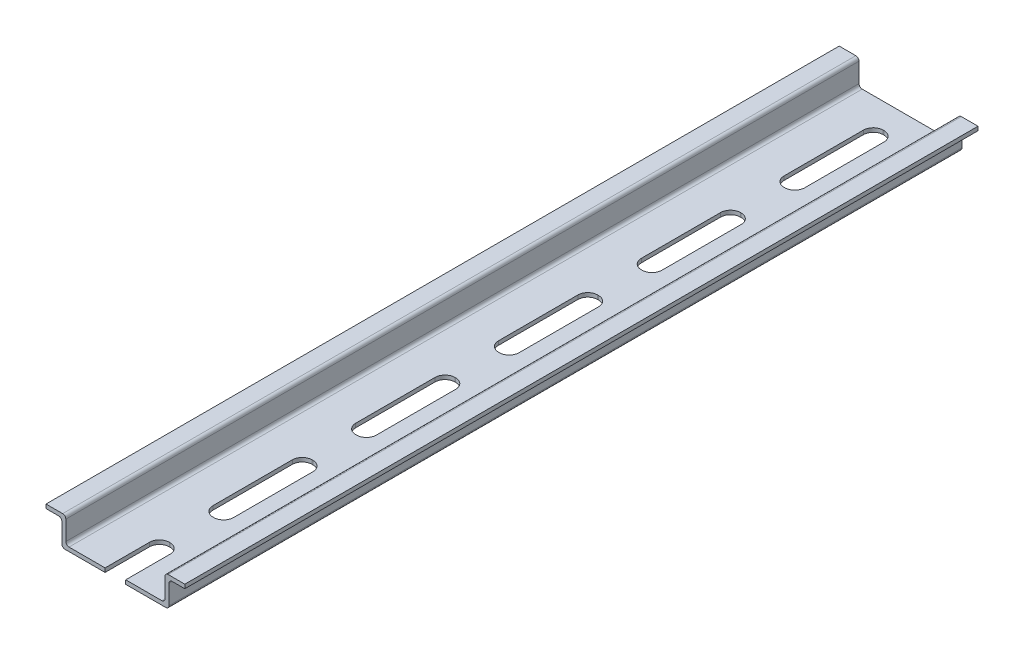
from build123d import *

# Parameters (mm, degrees)
BOSS_EXTRUDE1_DEPTH = 200
CUT_EXTRUDE1_DEPTH  = 204.143422242


with BuildPart() as part:
    # Sketch1 → Boss-Extrude1 (new body)
    with BuildSketch(Plane.XY):
        with BuildLine():
            Line((0, 0), (0, 1))
            Line((0, 1), (4.2, 1))
            ThreePointArc((4.2, 1), (4.765685425, 0.765685425), (5, 0.2))
            Line((5, 0.2), (5, -4.7))
            ThreePointArc((5, -4.7), (5.234314575, -5.265685425), (5.8, -5.5))
            Line((5.8, -5.5), (29.2, -5.5))
            ThreePointArc((29.2, -5.5), (29.765685425, -5.265685425), (30, -4.7))
            Line((30, -4.7), (30, 0.2))
            ThreePointArc((30, 0.2), (30.234314575, 0.765685425), (30.8, 1))
            Line((30.8, 1), (35, 1))
            Line((35, 1), (35, 0))
            Line((35, 0), (31.8, 0))
            ThreePointArc((31.8, 0), (31.234314575, -0.234314575), (31, -0.8))
            Line((31, -0.8), (31, -5.7))
            ThreePointArc((31, -5.7), (30.765685425, -6.265685425), (30.2, -6.5))
            Line((30.2, -6.5), (4.8, -6.5))
            ThreePointArc((4.8, -6.5), (4.234314575, -6.265685425), (4, -5.7))
            Line((4, -5.7), (4, -0.8))
            ThreePointArc((4, -0.8), (3.765685425, -0.234314575), (3.2, 0))
            Line((3.2, 0), (0, 0))
        make_face()
    extrude(amount=BOSS_EXTRUDE1_DEPTH)

    # Sketch2 → Cut-Extrude1 (cut, through all)
    with BuildSketch(Plane(origin=(0, -5.5, 0), x_dir=(1, 0, 0), z_dir=(0, 1, 0))):
        with BuildLine():
            Line((17.4, -6.300946702), (17.6, -6.300946702))
            ThreePointArc((17.6, -6.300946702), (19.367766953, -7.033179749), (20.1, -8.800946702))
            Line((20.1, -8.800946702), (20.1, -28.800946702))
            ThreePointArc((20.1, -28.800946702), (19.367766953, -30.568713655), (17.6, -31.300946702))
            Line((17.6, -31.300946702), (17.4, -31.300946702))
            ThreePointArc((17.4, -31.300946702), (15.632233047, -30.568713655), (14.9, -28.800946702))
            Line((14.9, -28.800946702), (14.9, -8.800946702))
            ThreePointArc((14.9, -8.800946702), (15.632233047, -7.033179749), (17.4, -6.300946702))
        make_face()
        with BuildLine():
            Line((14.9, -44.800946702), (14.9, -64.800946702))
            ThreePointArc((14.9, -64.800946702), (15.632233047, -66.568713655), (17.4, -67.300946702))
            Line((17.4, -67.300946702), (17.6, -67.300946702))
            ThreePointArc((17.6, -67.300946702), (19.367766953, -66.568713655), (20.1, -64.800946702))
            Line((20.1, -64.800946702), (20.1, -44.800946702))
            ThreePointArc((20.1, -44.800946702), (19.367766953, -43.033179749), (17.6, -42.300946702))
            Line((17.6, -42.300946702), (17.4, -42.300946702))
            ThreePointArc((17.4, -42.300946702), (15.632233047, -43.033179749), (14.9, -44.800946702))
        make_face()
        with BuildLine():
            Line((14.9, -80.800946702), (14.9, -100.800946702))
            ThreePointArc((14.9, -100.800946702), (15.632233047, -102.568713655), (17.4, -103.300946702))
            Line((17.4, -103.300946702), (17.6, -103.300946702))
            ThreePointArc((17.6, -103.300946702), (19.367766953, -102.568713655), (20.1, -100.800946702))
            Line((20.1, -100.800946702), (20.1, -80.800946702))
            ThreePointArc((20.1, -80.800946702), (19.367766953, -79.033179749), (17.6, -78.300946702))
            Line((17.6, -78.300946702), (17.4, -78.300946702))
            ThreePointArc((17.4, -78.300946702), (15.632233047, -79.033179749), (14.9, -80.800946702))
        make_face()
        with BuildLine():
            Line((14.9, -116.800946702), (14.9, -136.800946702))
            ThreePointArc((14.9, -136.800946702), (15.632233047, -138.568713655), (17.4, -139.300946702))
            Line((17.4, -139.300946702), (17.6, -139.300946702))
            ThreePointArc((17.6, -139.300946702), (19.367766953, -138.568713655), (20.1, -136.800946702))
            Line((20.1, -136.800946702), (20.1, -116.800946702))
            ThreePointArc((20.1, -116.800946702), (19.367766953, -115.033179749), (17.6, -114.300946702))
            Line((17.6, -114.300946702), (17.4, -114.300946702))
            ThreePointArc((17.4, -114.300946702), (15.632233047, -115.033179749), (14.9, -116.800946702))
        make_face()
        with BuildLine():
            Line((14.9, -152.800946702), (14.9, -172.800946702))
            ThreePointArc((14.9, -172.800946702), (15.632233047, -174.568713655), (17.4, -175.300946702))
            Line((17.4, -175.300946702), (17.6, -175.300946702))
            ThreePointArc((17.6, -175.300946702), (19.367766953, -174.568713655), (20.1, -172.800946702))
            Line((20.1, -172.800946702), (20.1, -152.800946702))
            ThreePointArc((20.1, -152.800946702), (19.367766953, -151.033179749), (17.6, -150.300946702))
            Line((17.6, -150.300946702), (17.4, -150.300946702))
            ThreePointArc((17.4, -150.300946702), (15.632233047, -151.033179749), (14.9, -152.800946702))
        make_face()
        with BuildLine():
            Line((14.9, -188.800946702), (14.9, -208.800946702))
            ThreePointArc((14.9, -208.800946702), (15.632233047, -210.568713655), (17.4, -211.300946702))
            Line((17.4, -211.300946702), (17.6, -211.300946702))
            ThreePointArc((17.6, -211.300946702), (19.367766953, -210.568713655), (20.1, -208.800946702))
            Line((20.1, -208.800946702), (20.1, -188.800946702))
            ThreePointArc((20.1, -188.800946702), (19.367766953, -187.033179749), (17.6, -186.300946702))
            Line((17.6, -186.300946702), (17.4, -186.300946702))
            ThreePointArc((17.4, -186.300946702), (15.632233047, -187.033179749), (14.9, -188.800946702))
        make_face()
    extrude(amount=-CUT_EXTRUDE1_DEPTH, mode=Mode.SUBTRACT)


solid = part.part
